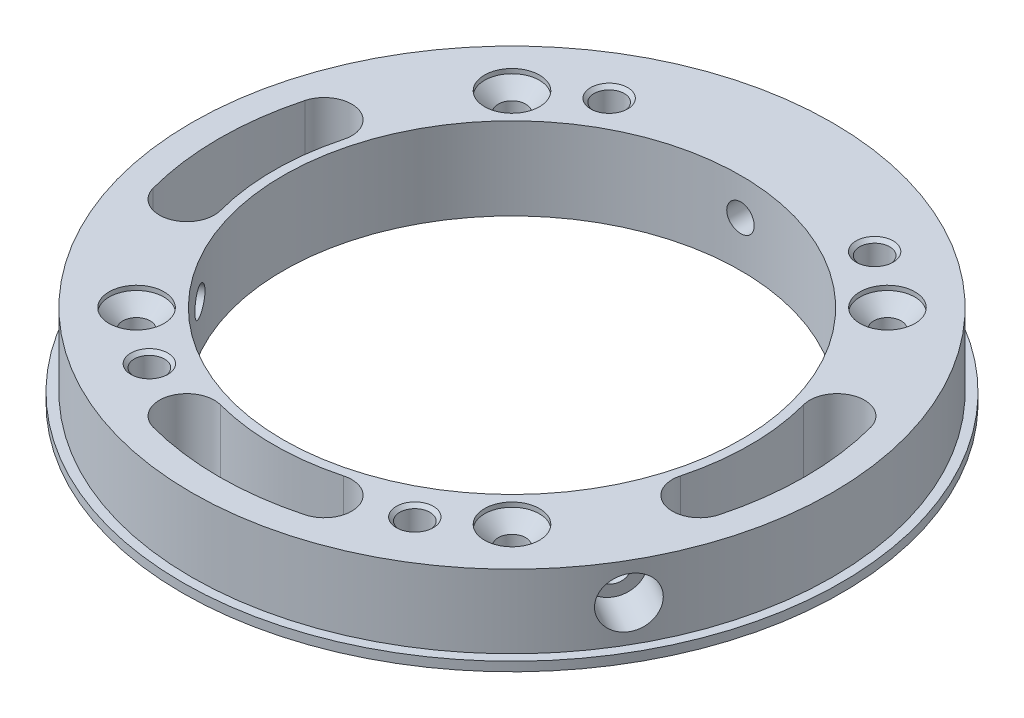
from build123d import *

# Parameters (mm, degrees)
SKETCH_5_R                   = 35
SKETCH_5_R_2                 = 25
EXTRUDE_1_DEPTH              = 9
SKETCH_17_R                  = 36
SKETCH_17_R_2                = 35
EXTRUDE_2_DEPTH              = 1
SKETCH_2_R                   = 1.5
CUT_EXTRUDE_1_DEPTH          = 57.044625077
HOLE_WIZARD_M4_4_D           = 3.3
HOLE_WIZARD_M4_4_CSINK_D     = 4.05
HOLE_WIZARD_M4_4_CSINK_ANGLE = 90
HOLE_WIZARD_1_AT_2_COUNT     = 2
HOLE_WIZARD_1_AT_2_PITCH     = 41.012193309
HOLE_WIZARD_1_AT_3_COUNT     = 2
HOLE_WIZARD_1_AT_3_PITCH     = 58
HOLE_WIZARD_1_AT_4_COUNT     = 2
HOLE_WIZARD_1_AT_4_PITCH     = 41.012193309
SKETCH_18_R                  = 1.5
CUT_EXTRUDE_2_DEPTH          = 30.2
SKETCH_19_R                  = 2.75
CUT_EXTRUDE_3_DEPTH          = 76.890974442
PATTERN_CIRCULAR_1_COUNT     = 3
CHAMFER_1_SIZE               = 1


with BuildPart() as part:
    # 草图5 → 凸台-拉伸1 (new body)
    with BuildSketch(Plane(origin=(0, 0, 0), x_dir=(1, 0, 0), z_dir=(0, 1, 0))):
        with Locations(Location((0, 0, 0), (0, 0, 270))):
            Circle(SKETCH_5_R)
        with Locations(Location((0, 0, 0), (0, 0, 270))):
            Circle(SKETCH_5_R_2, mode=Mode.SUBTRACT)
    extrude(amount=EXTRUDE_1_DEPTH)

    # 草图17 → 凸台-拉伸2 (add)
    with BuildSketch(Plane.XZ):
        with Locations(Location((0, 0, 0), (0, 0, 270))):
            Circle(SKETCH_17_R)
        with Locations(Location((0, 0, 0), (0, 0, 270))):
            Circle(SKETCH_17_R_2, mode=Mode.SUBTRACT)
    extrude(amount=-EXTRUDE_2_DEPTH)

    # 草图2 → 切除-拉伸1 (cut, through all)
    with BuildSketch(Plane(origin=(0, 0, 6), x_dir=(-1, 0, 0), z_dir=(0, -1, 0))):
        with Locations(Location((20.506096654, 26.506096654, 0), (0, 0, 90))):
            Circle(SKETCH_2_R)
        with Locations(Location((20.506096654, -14.506096654, 0), (0, 0, 90))):
            Circle(SKETCH_2_R)
        with Locations(Location((-20.506096654, -14.506096654, 0), (0, 0, 90))):
            Circle(SKETCH_2_R)
        with Locations(Location((-20.506096654, 26.506096654, 0), (0, 0, 90))):
            Circle(SKETCH_2_R)
        with BuildLine():
            ThreePointArc((30.909626441, -2.282209443), (32, 6), (30.909626441, 14.282209443))
            ThreePointArc((30.909626441, 14.282209443), (27.235391827, 16.403529787), (25.114071484, 12.729295173))
            ThreePointArc((25.114071484, 12.729295173), (26, 6), (25.114071484, -0.729295173))
            ThreePointArc((25.114071484, -0.729295173), (27.235391827, -4.403529787), (30.909626441, -2.282209443))
        make_face()
        with BuildLine():
            ThreePointArc((-8.282209443, -24.909626441), (0, -26), (8.282209443, -24.909626441))
            ThreePointArc((8.282209443, -24.909626441), (10.403529787, -21.235391827), (6.729295173, -19.114071484))
            ThreePointArc((6.729295173, -19.114071484), (0, -20), (-6.729295173, -19.114071484))
            ThreePointArc((-6.729295173, -19.114071484), (-10.403529787, -21.235391827), (-8.282209443, -24.909626441))
        make_face()
        with BuildLine():
            ThreePointArc((-30.909626441, 14.282209443), (-32, 6), (-30.909626441, -2.282209443))
            ThreePointArc((-30.909626441, -2.282209443), (-27.235391827, -4.403529787), (-25.114071484, -0.729295173))
            ThreePointArc((-25.114071484, -0.729295173), (-26, 6), (-25.114071484, 12.729295173))
            ThreePointArc((-25.114071484, 12.729295173), (-27.235391827, 16.403529787), (-30.909626441, 14.282209443))
        make_face()
    extrude(amount=-CUT_EXTRUDE_1_DEPTH, mode=Mode.SUBTRACT)

    # M4 螺纹孔4 (through all)
    with Locations(Plane(origin=(0, 9, 0), x_dir=(1, 0, 0), z_dir=(0, 1, 0))):
        with Locations((-14.5, 25.11473671), (14.5, 25.11473671), (14.5, -25.11473671), (-14.5, -25.11473671), (-29, 0), (29, 0)):
            CounterSinkHole(HOLE_WIZARD_M4_4_D / 2, HOLE_WIZARD_M4_4_CSINK_D / 2, counter_sink_angle=HOLE_WIZARD_M4_4_CSINK_ANGLE)

    # 草图15 → 孔1 (revolve, cut)
    with BuildSketch(Plane(origin=(-20.506096654, 9, 20.506096654), x_dir=(0, 0, 1), z_dir=(1, 0, 0))):
        Polygon((0, 0), (0, 9), (1.5, 9), (1.5, 2), (3, 0.5), (3, 0), align=None)
    hole_wizard_1 = revolve(axis=Axis((-20.506096654, 15.130023899, 20.506096654), (0, -1, 0)), mode=Mode.SUBTRACT)

    # 孔1 at 2: 孔1 ×2
    with Locations(*[(i * HOLE_WIZARD_1_AT_2_PITCH, 0, 0) for i in range(1, HOLE_WIZARD_1_AT_2_COUNT)]):
        add(hole_wizard_1, mode=Mode.SUBTRACT)

    # 孔1 at 3: 孔1 ×2
    with Locations(*[Vector(0.7071067811865474, 0, -0.7071067811865477) * (i * HOLE_WIZARD_1_AT_3_PITCH) for i in range(1, HOLE_WIZARD_1_AT_3_COUNT)]):
        add(hole_wizard_1, mode=Mode.SUBTRACT)

    # 孔1 at 4: 孔1 ×2
    with Locations(*[(0, 0, -i * HOLE_WIZARD_1_AT_4_PITCH) for i in range(1, HOLE_WIZARD_1_AT_4_COUNT)]):
        add(hole_wizard_1, mode=Mode.SUBTRACT)

    # 草图18 → 切除-拉伸2 (cut)
    with BuildSketch(Plane.XY):
        with Locations((0, 5)):
            Circle(SKETCH_18_R)
    cut_extrude_2 = extrude(amount=-CUT_EXTRUDE_2_DEPTH, mode=Mode.SUBTRACT)

    # 草图19 → 切除-拉伸3 (cut, through all)
    with BuildSketch(Plane.XY.offset(-30.2)):
        with Locations((0, 5)):
            Circle(SKETCH_19_R)
    cut_extrude_3 = extrude(amount=-CUT_EXTRUDE_3_DEPTH, mode=Mode.SUBTRACT)

    # 阵列(圆周)1: 切除-拉伸2, 切除-拉伸3 ×3 about axis
    pattern_circular_1_axis = Axis((0, 0, 0), (0, 1, 0))
    add([cut_extrude_2.rotate(pattern_circular_1_axis, i * 360 / PATTERN_CIRCULAR_1_COUNT) for i in range(1, PATTERN_CIRCULAR_1_COUNT)], mode=Mode.SUBTRACT)
    add([cut_extrude_3.rotate(pattern_circular_1_axis, i * 360 / PATTERN_CIRCULAR_1_COUNT) for i in range(1, PATTERN_CIRCULAR_1_COUNT)], mode=Mode.SUBTRACT)

    # 倒角1
    chamfer_1_edges = [part.edges().sort_by_distance(p)[0] for p in [
        (-27.235391827, 0, 10.403529787),
        (-32, 0, 0),
        (-27.235391827, 0, -10.403529787),
        (-26, 0, 0),
        (10.403529787, 0, 27.235391827),
        (0, 0, 32),
        (-10.403529787, 0, 27.235391827),
        (0, 0, 26),
        (27.235391827, 0, -10.403529787),
        (32, 0, 0),
        (27.235391827, 0, 10.403529787),
        (26, 0, 0),
    ]]
    chamfer(chamfer_1_edges, length=CHAMFER_1_SIZE - 0.0001)  # a hair under: the kernel refuses the full size


solid = part.part
